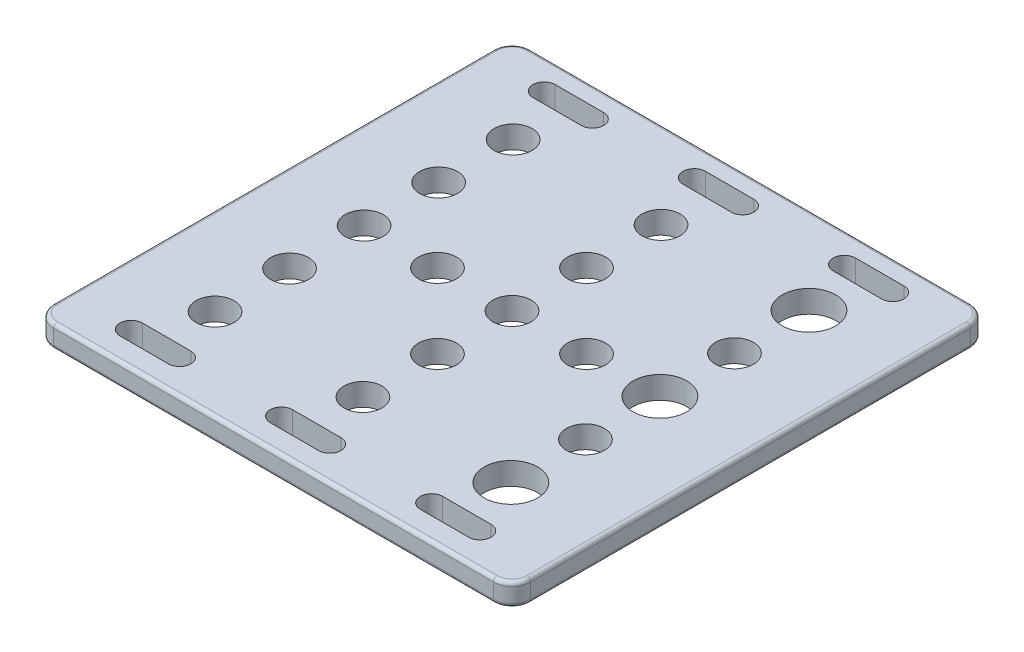
from build123d import *

# Parameters (mm, degrees)
SKETCH1_R           = 2.55
SKETCH1_R_2         = 3.6
BOSS_EXTRUDE1_DEPTH = 3
FILLET1_R           = 0.5


with BuildPart() as part:
    # Sketch1 → Boss-Extrude1 (new body)
    with BuildSketch(Plane(origin=(0, 0, 0), x_dir=(1, 0, 0), z_dir=(0, 1, 0))):
        with BuildLine():
            Line((29.5, 32), (-29.5, 32))
            ThreePointArc((-29.5, 32), (-31.267766953, 31.267766953), (-32, 29.5))
            Line((-32, 29.5), (-32, -29.5))
            ThreePointArc((-32, -29.5), (-31.267766953, -31.267766953), (-29.5, -32))
            Line((-29.5, -32), (29.5, -32))
            ThreePointArc((29.5, -32), (31.267766953, -31.267766953), (32, -29.5))
            Line((32, -29.5), (32, 29.5))
            ThreePointArc((32, 29.5), (31.267766953, 31.267766953), (29.5, 32))
        make_face()
        with Locations((-10.25, 0.25)):
            Circle(SKETCH1_R, mode=Mode.SUBTRACT)
        with Locations((19.6, 0.25)):
            Circle(SKETCH1_R_2, mode=Mode.SUBTRACT)
        with Locations((19.6, 10.25)):
            Circle(SKETCH1_R, mode=Mode.SUBTRACT)
        with Locations((-0.25, 10.25)):
            Circle(SKETCH1_R, mode=Mode.SUBTRACT)
        with Locations((19.6, -19.75)):
            Circle(SKETCH1_R_2, mode=Mode.SUBTRACT)
        with Locations((-0.25, -9.75)):
            Circle(SKETCH1_R, mode=Mode.SUBTRACT)
        with Locations((19.6, -9.75)):
            Circle(SKETCH1_R, mode=Mode.SUBTRACT)
        with Locations((9.75, 0.25)):
            Circle(SKETCH1_R, mode=Mode.SUBTRACT)
        with Locations((-0.25, 0.25)):
            Circle(SKETCH1_R, mode=Mode.SUBTRACT)
        with Locations((-20.1, -19.75)):
            Circle(SKETCH1_R, mode=Mode.SUBTRACT)
        with Locations((-20.1, -9.75)):
            Circle(SKETCH1_R, mode=Mode.SUBTRACT)
        with Locations((-20.1, 0.25)):
            Circle(SKETCH1_R, mode=Mode.SUBTRACT)
        with Locations((-20.1, 10.25)):
            Circle(SKETCH1_R, mode=Mode.SUBTRACT)
        with Locations((19.6, 20.25)):
            Circle(SKETCH1_R_2, mode=Mode.SUBTRACT)
        with Locations((-20.1, 20.25)):
            Circle(SKETCH1_R, mode=Mode.SUBTRACT)
        with Locations((-0.25, -19.75)):
            Circle(SKETCH1_R, mode=Mode.SUBTRACT)
        with Locations((-0.25, 20.25)):
            Circle(SKETCH1_R, mode=Mode.SUBTRACT)
        with BuildLine():
            Line((3, 26.45), (-3.500000052, 26.45))
            ThreePointArc((-3.500000052, 26.45), (-5.000000052, 27.95), (-3.500000052, 29.45))
            Line((-3.500000052, 29.45), (3, 29.45))
            ThreePointArc((3, 29.45), (4.5, 27.95), (3, 26.45))
        make_face(mode=Mode.SUBTRACT)
        with BuildLine():
            Line((-23.649999471, 29.45), (-17.15, 29.45))
            ThreePointArc((-17.15, 29.45), (-15.65, 27.95), (-17.15, 26.45))
            Line((-17.15, 26.45), (-23.649999471, 26.45))
            ThreePointArc((-23.649999471, 26.45), (-25.149999471, 27.95), (-23.649999471, 29.45))
        make_face(mode=Mode.SUBTRACT)
        with BuildLine():
            Line((16.649999628, 29.45), (23.15, 29.45))
            ThreePointArc((23.15, 29.45), (24.65, 27.95), (23.15, 26.45))
            Line((23.15, 26.45), (16.649999628, 26.45))
            ThreePointArc((16.649999628, 26.45), (15.149999628, 27.95), (16.649999628, 29.45))
        make_face(mode=Mode.SUBTRACT)
        with BuildLine():
            Line((-17.15, -28.95), (-23.649999471, -28.95))
            ThreePointArc((-23.649999471, -28.95), (-25.149999471, -27.45), (-23.649999471, -25.95))
            Line((-23.649999471, -25.95), (-17.15, -25.95))
            ThreePointArc((-17.15, -25.95), (-15.65, -27.45), (-17.15, -28.95))
        make_face(mode=Mode.SUBTRACT)
        with BuildLine():
            Line((-3.500000052, -25.95), (3, -25.95))
            ThreePointArc((3, -25.95), (4.5, -27.45), (3, -28.95))
            Line((3, -28.95), (-3.500000052, -28.95))
            ThreePointArc((-3.500000052, -28.95), (-5.000000052, -27.45), (-3.500000052, -25.95))
        make_face(mode=Mode.SUBTRACT)
        with BuildLine():
            Line((23.15, -28.95), (16.649999628, -28.95))
            ThreePointArc((16.649999628, -28.95), (15.149999628, -27.45), (16.649999628, -25.95))
            Line((16.649999628, -25.95), (23.15, -25.95))
            ThreePointArc((23.15, -25.95), (24.65, -27.45), (23.15, -28.95))
        make_face(mode=Mode.SUBTRACT)
    extrude(amount=BOSS_EXTRUDE1_DEPTH)

    # Fillet1
    fillet1_edges = [part.edges().sort_by_distance(p)[0] for p in [
        (31.267766953, 0, 31.267766953),
        (32, 0, 0),
        (31.267766953, 0, -31.267766953),
        (0, 0, -32),
        (-31.267766953, 0, -31.267766953),
        (-32, 0, 0),
        (-31.267766953, 0, 31.267766953),
        (0, 0, 32),
        (-32, 3, 0),
        (-31.267766953, 3, 31.267766953),
        (-31.267766953, 3, -31.267766953),
        (0, 3, -32),
        (31.267766953, 3, -31.267766953),
        (32, 3, 0),
        (31.267766953, 3, 31.267766953),
        (0, 3, 32),
    ]]
    fillet(fillet1_edges, radius=FILLET1_R)


solid = part.part
